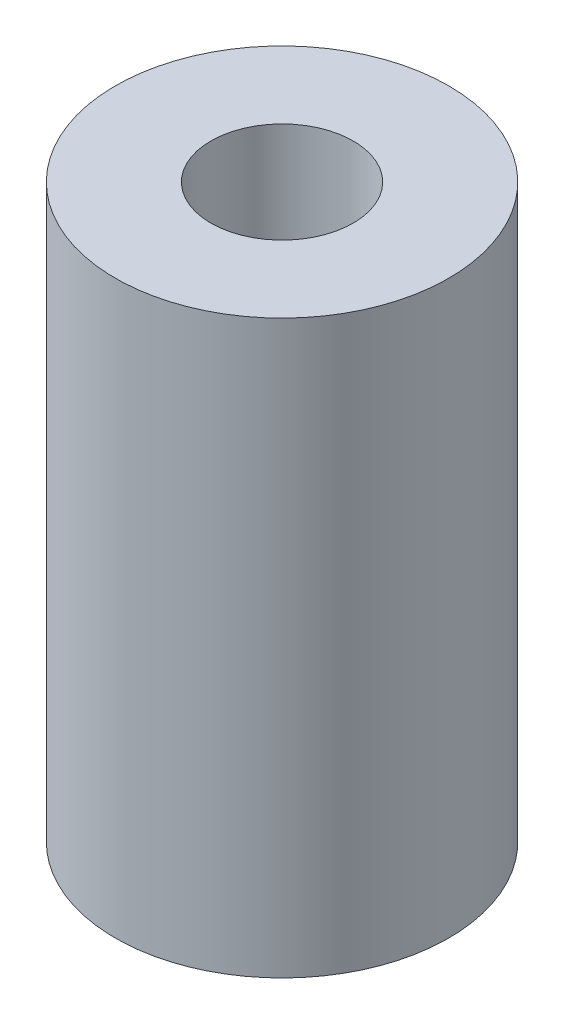
from build123d import *

# Parameters (mm, degrees)
SKETCH1_R             = 4.445
BOSS_EXTRUDE1_DEPTH   = 15.24
F_6_CLEARANCE_HOLE1_D = 3.7973


with BuildPart() as part:
    # Sketch1 → Boss-Extrude1 (new body)
    with BuildSketch(Plane(origin=(0, 0, 0), x_dir=(1, 0, 0), z_dir=(0, 1, 0))):
        Circle(SKETCH1_R)
    extrude(amount=BOSS_EXTRUDE1_DEPTH)

    # #6 Clearance Hole1 (through all)
    with Locations(Plane(origin=(0, 15.24, 0), x_dir=(1, 0, 0), z_dir=(0, 1, 0))):
        with Locations((0, 0)):
            Hole(F_6_CLEARANCE_HOLE1_D / 2)


solid = part.part
